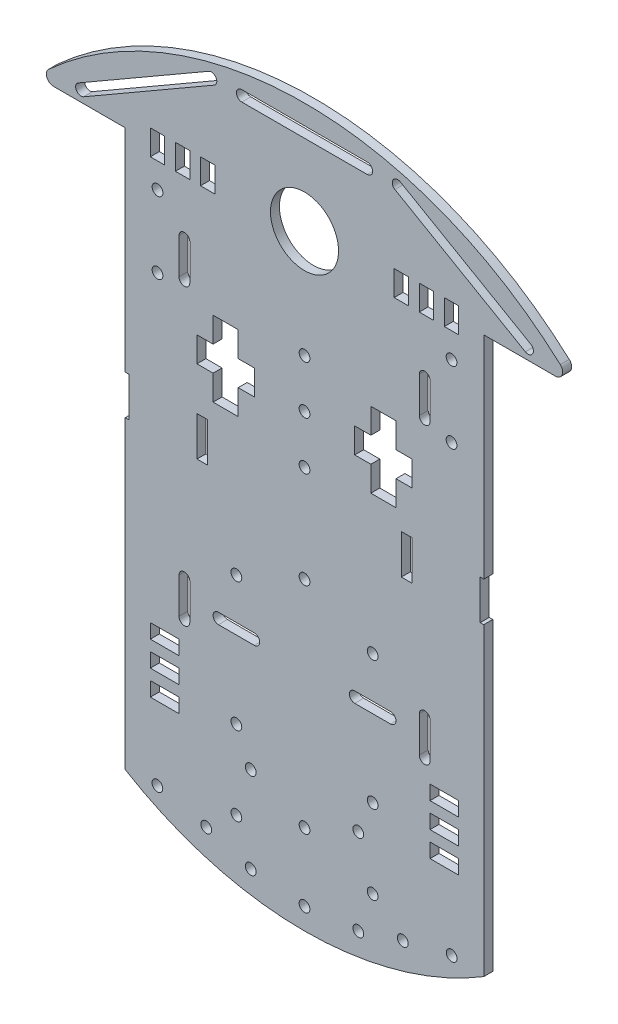
from build123d import *

# Parameters (mm, degrees)
BOSS_EXTRU_1_DEPTH         = 2.5
ESQUISSE2_R                = 9.5
ENL_V_MAT_EXTRU_1_DEPTH    = 223.451892429
ESQUISSE3_W                = 4
ESQUISSE3_H                = 7
ENL_V_MAT_EXTRU_2_DEPTH    = 223.451892429
R_P_TITION_LIN_AIRE1_COUNT = 3
R_P_TITION_LIN_AIRE1_PITCH = 7
ENL_V_MAT_EXTRU_3_DEPTH    = 223.451892429
ESQUISSE5_W                = 3
ESQUISSE5_H                = 11
ENL_V_MAT_EXTRU_4_DEPTH    = 223.451892429
R_P_TITION_LIN_AIRE2_COUNT = 2
R_P_TITION_LIN_AIRE2_PITCH = 22
ESQUISSE6_R                = 1.5
ENL_V_MAT_EXTRU_5_DEPTH    = 223.451892429
ESQUISSE7_W                = 8
ESQUISSE7_H                = 4
ENL_V_MAT_EXTRU_6_DEPTH    = 223.451892429
SYM_TRIE1_COPY_1_SKETCH_W  = 4
SYM_TRIE1_COPY_1_SKETCH_H  = 7
SYM_TRIE1_COPY_1_DEPTH     = 223.451892429
SYM_TRIE1_COPY_2_SKETCH_W  = 4
SYM_TRIE1_COPY_2_SKETCH_H  = 7
SYM_TRIE1_COPY_2_DEPTH     = 223.451892429
SYM_TRIE1_COPY_3_SKETCH_W  = 3
SYM_TRIE1_COPY_3_SKETCH_H  = 11
SYM_TRIE1_COPY_3_DEPTH     = 223.451892429
ESQUISSE8_R                = 1.5
ENL_V_MAT_EXTRU_7_DEPTH    = 10


with BuildPart() as part:
    # Esquisse1 → Boss.-Extru.1 (new body)
    with BuildSketch(Plane.XY):
        with BuildLine():
            Line((100, 155), (119.994239394, 155))
            ThreePointArc((119.994239394, 155), (121.860222821, 156.2802043), (121.337366241, 158.48189415))
            ThreePointArc((121.337366241, 158.48189415), (50, 186), (-21.337366241, 158.48189415))
            ThreePointArc((-21.337366241, 158.48189415), (-21.860222821, 156.2802043), (-19.994239394, 155))
            Line((-19.994239394, 155), (0, 155))
            Line((0, 155), (0, 0))
            ThreePointArc((0, 0), (50, -14), (100, 0))
            Line((100, 0), (100, 155))
        make_face()
    extrude(amount=BOSS_EXTRU_1_DEPTH)

    # Esquisse2 → Enlèv. mat.-Extru.1 (cut, through all)
    with BuildSketch(Plane(origin=(0, 0, 0), x_dir=(-1, 0, 0), z_dir=(0, 0, -1))):
        with Locations((-50, 155)):
            Circle(ESQUISSE2_R)
    extrude(amount=-ENL_V_MAT_EXTRU_1_DEPTH, mode=Mode.SUBTRACT)

    # Esquisse3 → Enlèv. mat.-Extru.2 (cut, through all)
    with BuildSketch(Plane(origin=(0, 0, 0), x_dir=(-1, 0, 0), z_dir=(0, 0, -1))):
        with Locations((-91, 155)):
            Rectangle(ESQUISSE3_W, ESQUISSE3_H)
    enl_v_mat_extru_2 = extrude(amount=-ENL_V_MAT_EXTRU_2_DEPTH, mode=Mode.SUBTRACT)

    # Répétition linéaire1: Enlèv. mat.-Extru.2 ×3
    with Locations(*[(-i * R_P_TITION_LIN_AIRE1_PITCH, 0, 0) for i in range(1, R_P_TITION_LIN_AIRE1_COUNT)]):
        add(enl_v_mat_extru_2, mode=Mode.SUBTRACT)

    # Esquisse4 → Enlèv. mat.-Extru.3 (cut, through all)
    with BuildSketch(Plane(origin=(0, 0, 0), x_dir=(-1, 0, 0), z_dir=(0, 0, -1))):
        Polygon((-75.5, 122), (-68.5, 122), (-68.5, 115), (-64, 115), (-64, 108), (-68.5, 108), (-68.5, 101), (-75.5, 101), (-75.5, 108), (-80, 108), (-80, 115), (-75.5, 115), align=None)
    enl_v_mat_extru_3 = extrude(amount=-ENL_V_MAT_EXTRU_3_DEPTH, mode=Mode.SUBTRACT)

    # Esquisse5 → Enlèv. mat.-Extru.4 (cut, through all)
    with BuildSketch(Plane(origin=(0, 0, 0), x_dir=(-1, 0, 0), z_dir=(0, 0, -1))):
        with Locations((-78.5, 90.5)):
            Rectangle(ESQUISSE5_W, ESQUISSE5_H)
    enl_v_mat_extru_4 = extrude(amount=-ENL_V_MAT_EXTRU_4_DEPTH, mode=Mode.SUBTRACT)

    # Répétition linéaire2: Enlèv. mat.-Extru.4 ×2
    with Locations(*[(i * R_P_TITION_LIN_AIRE2_PITCH, 0, 0) for i in range(1, R_P_TITION_LIN_AIRE2_COUNT)]):
        add(enl_v_mat_extru_4, mode=Mode.SUBTRACT)

    # Esquisse6 → Enlèv. mat.-Extru.5 (cut, through all)
    with BuildSketch(Plane(origin=(0, 0, 0), x_dir=(-1, 0, 0), z_dir=(0, 0, -1))):
        with Locations((-91, 144.5)):
            Circle(ESQUISSE6_R)
        with Locations((-91, 124.5)):
            Circle(ESQUISSE6_R)
        with Locations((-65, 17.5)):
            Circle(ESQUISSE6_R)
        with Locations((-69, 26.5)):
            Circle(ESQUISSE6_R)
        with Locations((-91.030029605, 0.602552335)):
            Circle(ESQUISSE6_R)
        with Locations((-77.401365798, -2.600496654)):
            Circle(ESQUISSE6_R)
        with Locations((-69, 4.5)):
            Circle(ESQUISSE6_R)
        with Locations((-65, -6.5)):
            Circle(ESQUISSE6_R)
        with Locations((-69, 62.5)):
            Circle(ESQUISSE6_R)
        with BuildLine():
            Line((-82, 54.5), (-82, 44.5))
            ThreePointArc((-82, 44.5), (-83.5, 43), (-85, 44.5))
            Line((-85, 44.5), (-85, 54.5))
            ThreePointArc((-85, 54.5), (-83.5, 56), (-82, 54.5))
        make_face()
        with BuildLine():
            Line((-74, 51), (-64, 51))
            ThreePointArc((-64, 51), (-62.5, 49.5), (-64, 48))
            Line((-64, 48), (-74, 48))
            ThreePointArc((-74, 48), (-75.5, 49.5), (-74, 51))
        make_face()
        with BuildLine():
            Line((-82, 136.5), (-82, 126.5))
            ThreePointArc((-82, 126.5), (-83.5, 125), (-85, 126.5))
            Line((-85, 126.5), (-85, 136.5))
            ThreePointArc((-85, 136.5), (-83.5, 138), (-82, 136.5))
        make_face()
        with BuildLine():
            Line((-113.087366241, 159.299038106), (-76.714299282, 180.299038106))
            ThreePointArc((-76.714299282, 180.299038106), (-74.665261177, 179.75), (-75.214299282, 177.700961894))
            Line((-75.214299282, 177.700961894), (-111.587366241, 156.700961894))
            ThreePointArc((-111.587366241, 156.700961894), (-113.636404347, 157.25), (-113.087366241, 159.299038106))
        make_face()
    enl_v_mat_extru_5 = extrude(amount=-ENL_V_MAT_EXTRU_5_DEPTH, mode=Mode.SUBTRACT)

    # Esquisse7 → Enlèv. mat.-Extru.6 (cut, through all)
    with BuildSketch(Plane(origin=(0, 0, 0), x_dir=(-1, 0, 0), z_dir=(0, 0, -1))):
        with Locations((-89, 37)):
            Rectangle(ESQUISSE7_W, ESQUISSE7_H)
        with Locations((-89, 30)):
            Rectangle(ESQUISSE7_W, ESQUISSE7_H)
        with Locations((-89, 23)):
            Rectangle(ESQUISSE7_W, ESQUISSE7_H)
    enl_v_mat_extru_6 = extrude(amount=-ENL_V_MAT_EXTRU_6_DEPTH, mode=Mode.SUBTRACT)

    # Symétrie1: Enlèv. mat.-Extru.2, Enlèv. mat.-Extru.3, Enlèv. mat.-Extru.4, Enlèv. mat.-Extru.5, Enlèv. mat.-Extru.6 across plane
    add(enl_v_mat_extru_2.mirror(Plane(origin=(50, 0, 0), x_dir=(0, 0, 1), z_dir=(1, 0, 0))), mode=Mode.SUBTRACT)
    add(enl_v_mat_extru_3.mirror(Plane(origin=(50, 0, 0), x_dir=(0, 0, 1), z_dir=(1, 0, 0))), mode=Mode.SUBTRACT)
    add(enl_v_mat_extru_4.mirror(Plane(origin=(50, 0, 0), x_dir=(0, 0, 1), z_dir=(1, 0, 0))), mode=Mode.SUBTRACT)
    add(enl_v_mat_extru_5.mirror(Plane(origin=(50, 0, 0), x_dir=(0, 0, 1), z_dir=(1, 0, 0))), mode=Mode.SUBTRACT)
    add(enl_v_mat_extru_6.mirror(Plane(origin=(50, 0, 0), x_dir=(0, 0, 1), z_dir=(1, 0, 0))), mode=Mode.SUBTRACT)

    # Symétrie1 copy 1 sketch → Symétrie1 copy 1 (cut, through all)
    with BuildSketch(Plane(origin=(107, 0, 0), x_dir=(1, 0, 0), z_dir=(0, 0, -1))):
        with Locations((-91, -155)):
            Rectangle(SYM_TRIE1_COPY_1_SKETCH_W, SYM_TRIE1_COPY_1_SKETCH_H)
    extrude(amount=-SYM_TRIE1_COPY_1_DEPTH, mode=Mode.SUBTRACT)

    # Symétrie1 copy 2 sketch → Symétrie1 copy 2 (cut, through all)
    with BuildSketch(Plane(origin=(114, 0, 0), x_dir=(1, 0, 0), z_dir=(0, 0, -1))):
        with Locations((-91, -155)):
            Rectangle(SYM_TRIE1_COPY_2_SKETCH_W, SYM_TRIE1_COPY_2_SKETCH_H)
    extrude(amount=-SYM_TRIE1_COPY_2_DEPTH, mode=Mode.SUBTRACT)

    # Symétrie1 copy 3 sketch → Symétrie1 copy 3 (cut, through all)
    with BuildSketch(Plane(origin=(78, 0, 0), x_dir=(1, 0, 0), z_dir=(0, 0, -1))):
        with Locations((-78.5, -90.5)):
            Rectangle(SYM_TRIE1_COPY_3_SKETCH_W, SYM_TRIE1_COPY_3_SKETCH_H)
    extrude(amount=-SYM_TRIE1_COPY_3_DEPTH, mode=Mode.SUBTRACT)

    # Esquisse8 → Enlèv. mat.-Extru.7 (cut)
    with BuildSketch(Plane(origin=(0, 0, 0), x_dir=(-1, 0, 0), z_dir=(0, 0, -1))):
        with Locations((-50, 111.5)):
            Circle(ESQUISSE8_R)
        with Locations((-50, 125)):
            Circle(ESQUISSE8_R)
        with Locations((-50, 98)):
            Circle(ESQUISSE8_R)
        with Locations((-50, 71)):
            Circle(ESQUISSE8_R)
        with Locations((-50, -8)):
            Circle(ESQUISSE8_R)
        with Locations((-50, 11)):
            Circle(ESQUISSE8_R)
        with BuildLine():
            Line((-67.5, 180.480620573), (-32.5, 180.480620573))
            ThreePointArc((-32.5, 180.480620573), (-31, 178.980620573), (-32.5, 177.480620573))
            Line((-32.5, 177.480620573), (-67.5, 177.480620573))
            ThreePointArc((-67.5, 177.480620573), (-69, 178.980620573), (-67.5, 180.480620573))
        make_face()
    extrude(amount=-ENL_V_MAT_EXTRU_7_DEPTH, mode=Mode.SUBTRACT)


solid = part.part
